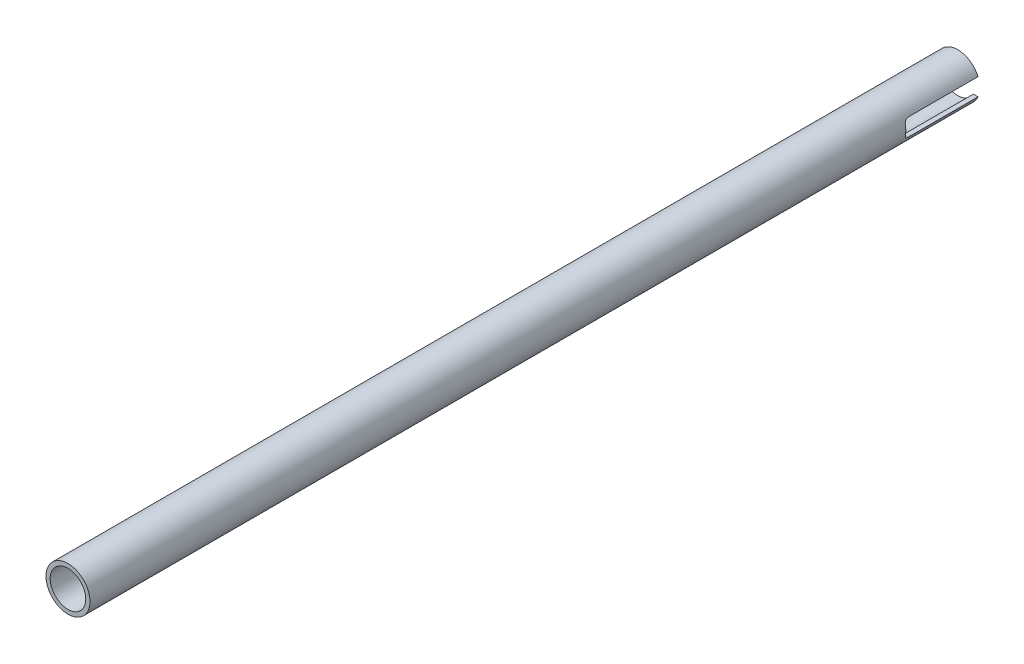
from build123d import *

# Parameters (mm, degrees)
SKETCH1_R               = 8.001
SKETCH1_R_2             = 6.477
BOSS_EXTRUDE1_DEPTH     = 323.85
CUT_EXTRUDE2_DEPTH      = 325.047611474
CUT_EXTRUDE2_DEPTH_BACK = 325.047611474


with BuildPart() as part:
    # Sketch1 → Boss-Extrude1 (new body)
    with BuildSketch(Plane.XY):
        Circle(SKETCH1_R)
        Circle(SKETCH1_R_2, mode=Mode.SUBTRACT)
    extrude(amount=BOSS_EXTRUDE1_DEPTH)

    # Sketch2 → Cut-Extrude2 (cut, two sides: drawn at the far end of the back side and taken through both)
    with BuildSketch(Plane(origin=(0, 0, 0), x_dir=(0, 0, -1), z_dir=(1, 0, 0)).offset(-CUT_EXTRUDE2_DEPTH_BACK)):
        with BuildLine():
            Line((658.085566807, 3.175), (0, 3.175))
            Line((0, 3.175), (-25.4, 3.175))
            ThreePointArc((-25.4, 3.175), (-26.477630735, 2.728630735), (-26.924, 1.651))
            Line((-26.924, 1.651), (-26.924, -1.651))
            ThreePointArc((-26.924, -1.651), (-26.477630735, -2.728630735), (-25.4, -3.175))
            Line((-25.4, -3.175), (0, -3.175))
            Line((0, -3.175), (658.085566807, -3.175))
            Line((658.085566807, -3.175), (1974.256700422, -3.175))
            Line((1974.256700422, -3.175), (1974.256700422, 3.175))
            Line((1974.256700422, 3.175), (658.085566807, 3.175))
        make_face()
    extrude(amount=CUT_EXTRUDE2_DEPTH + CUT_EXTRUDE2_DEPTH_BACK, mode=Mode.SUBTRACT)


solid = part.part
